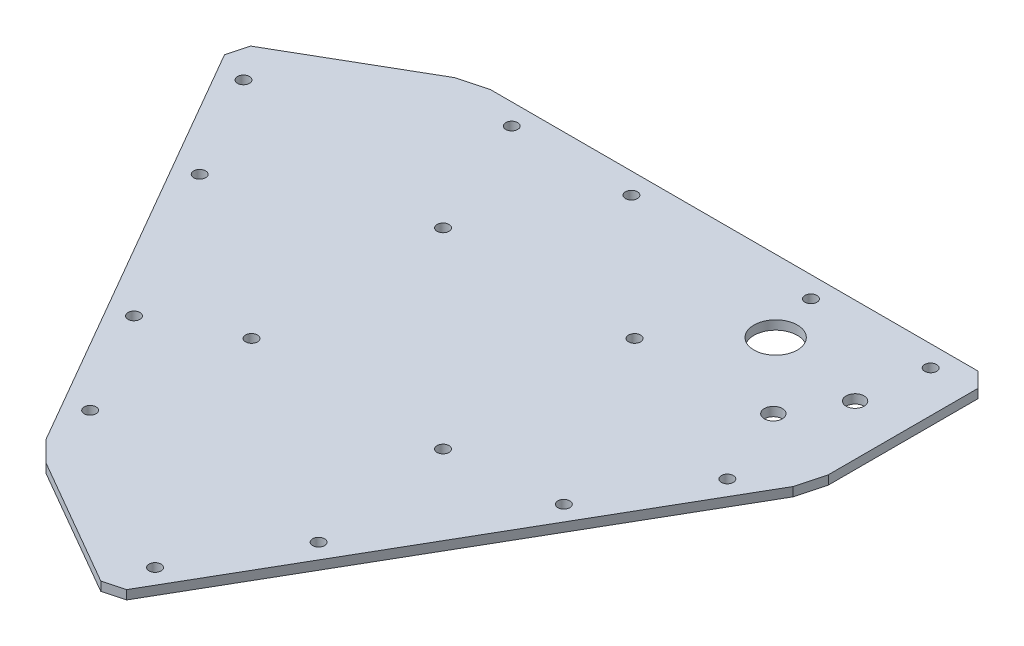
from build123d import *

# Parameters (mm, degrees)
EXTRUSION1_DEPTH              = 3
ENL_V_MAT_EXTRU_14_REACH      = 176.1
ESQUISSE8_R                   = 2
ENL_V_MAT_EXTRU_15_DEPTH      = 175.099861741
ENL_V_MAT_EXTRU_15_DEPTH_BACK = 175.099861741
ESQUISSE9_R                   = 2
ESQUISSE11_R                  = 7.25
ESQUISSE11_R_2                = 3
ENL_V_MAT_EXTRU_17_DEPTH      = 175.099861741


with BuildPart() as part:
    # Esquisse1 → Extrusion1 (new body)
    with BuildSketch(Plane(origin=(0, 0, 0), x_dir=(1, 0, 0), z_dir=(0, 1, 0))):
        Polygon((-64.179491924, 79.940798285), (98.820508076, 79.940798285), (103.820508076, 74.940798285), (103.820508076, 24.940798285), (101.320508076, 15.610671266), (19.820508076, -125.551469551), (12.990381057, -127.38159657), (-30.310889132, -102.38159657), (-37.141016151, -95.551469551), (-118.641016151, 45.610671266), (-116.810889132, 52.440798285), (-73.509618943, 77.440798285), align=None)
    extrude(amount=EXTRUSION1_DEPTH)

    # Esquisse8 → Enlèv. mat.-Extru.14 (cut, up to next)
    with BuildSketch(Plane(origin=(0, 3, 0), x_dir=(1, 0, 0), z_dir=(0, 1, 0)), mode=Mode.PRIVATE) as enl_v_mat_extru_14_sk1:
        with Locations((-108.168584287, 41.471887198)):
            Circle(ESQUISSE8_R)
    enl_v_mat_extru_14_tool1 = extrude(enl_v_mat_extru_14_sk1.sketch, amount=-ENL_V_MAT_EXTRU_14_REACH, mode=Mode.PRIVATE) & part.part
    # Esquisse8 → Enlèv. mat.-Extru.14 (cut, up to next)
    with BuildSketch(Plane(origin=(0, 3, 0), x_dir=(1, 0, 0), z_dir=(0, 1, 0)), mode=Mode.PRIVATE) as enl_v_mat_extru_14_sk2:
        with Locations((90, 72.940798285)):
            Circle(ESQUISSE8_R)
    enl_v_mat_extru_14_tool2 = extrude(enl_v_mat_extru_14_sk2.sketch, amount=-ENL_V_MAT_EXTRU_14_REACH, mode=Mode.PRIVATE) & part.part
    # Esquisse8 → Enlèv. mat.-Extru.14 (cut, up to next)
    with BuildSketch(Plane(origin=(0, 3, 0), x_dir=(1, 0, 0), z_dir=(0, 1, 0)), mode=Mode.PRIVATE) as enl_v_mat_extru_14_sk3:
        with Locations((50, 72.940798285)):
            Circle(ESQUISSE8_R)
    enl_v_mat_extru_14_tool3 = extrude(enl_v_mat_extru_14_sk3.sketch, amount=-ENL_V_MAT_EXTRU_14_REACH, mode=Mode.PRIVATE) & part.part
    # Esquisse8 → Enlèv. mat.-Extru.14 (cut, up to next)
    with BuildSketch(Plane(origin=(0, 3, 0), x_dir=(1, 0, 0), z_dir=(0, 1, 0)), mode=Mode.PRIVATE) as enl_v_mat_extru_14_sk4:
        with Locations((-58.168584287, -45.13065318)):
            Circle(ESQUISSE8_R)
    enl_v_mat_extru_14_tool4 = extrude(enl_v_mat_extru_14_sk4.sketch, amount=-ENL_V_MAT_EXTRU_14_REACH, mode=Mode.PRIVATE) & part.part
    # Esquisse8 → Enlèv. mat.-Extru.14 (cut, up to next)
    with BuildSketch(Plane(origin=(0, 3, 0), x_dir=(1, 0, 0), z_dir=(0, 1, 0)), mode=Mode.PRIVATE) as enl_v_mat_extru_14_sk5:
        with Locations((-38.168584287, -79.771669332)):
            Circle(ESQUISSE8_R)
    enl_v_mat_extru_14_tool5 = extrude(enl_v_mat_extru_14_sk5.sketch, amount=-ENL_V_MAT_EXTRU_14_REACH, mode=Mode.PRIVATE) & part.part
    # Esquisse8 → Enlèv. mat.-Extru.14 (cut, up to next)
    with BuildSketch(Plane(origin=(0, 3, 0), x_dir=(1, 0, 0), z_dir=(0, 1, 0)), mode=Mode.PRIVATE) as enl_v_mat_extru_14_sk6:
        with Locations((-10, 72.940798285)):
            Circle(ESQUISSE8_R)
    enl_v_mat_extru_14_tool6 = extrude(enl_v_mat_extru_14_sk6.sketch, amount=-ENL_V_MAT_EXTRU_14_REACH, mode=Mode.PRIVATE) & part.part
    # Esquisse8 → Enlèv. mat.-Extru.14 (cut, up to next)
    with BuildSketch(Plane(origin=(0, 3, 0), x_dir=(1, 0, 0), z_dir=(0, 1, 0)), mode=Mode.PRIVATE) as enl_v_mat_extru_14_sk7:
        with Locations((-50, 72.940798285)):
            Circle(ESQUISSE8_R)
    enl_v_mat_extru_14_tool7 = extrude(enl_v_mat_extru_14_sk7.sketch, amount=-ENL_V_MAT_EXTRU_14_REACH, mode=Mode.PRIVATE) & part.part
    # Esquisse8 → Enlèv. mat.-Extru.14 (cut, up to next)
    with BuildSketch(Plane(origin=(0, 3, 0), x_dir=(1, 0, 0), z_dir=(0, 1, 0)), mode=Mode.PRIVATE) as enl_v_mat_extru_14_sk8:
        with Locations((18.168584287, -114.412685483)):
            Circle(ESQUISSE8_R)
    enl_v_mat_extru_14_tool8 = extrude(enl_v_mat_extru_14_sk8.sketch, amount=-ENL_V_MAT_EXTRU_14_REACH, mode=Mode.PRIVATE) & part.part
    # Esquisse8 → Enlèv. mat.-Extru.14 (cut, up to next)
    with BuildSketch(Plane(origin=(0, 3, 0), x_dir=(1, 0, 0), z_dir=(0, 1, 0)), mode=Mode.PRIVATE) as enl_v_mat_extru_14_sk9:
        with Locations((38.168584287, -79.771669332)):
            Circle(ESQUISSE8_R)
    enl_v_mat_extru_14_tool9 = extrude(enl_v_mat_extru_14_sk9.sketch, amount=-ENL_V_MAT_EXTRU_14_REACH, mode=Mode.PRIVATE) & part.part
    # Esquisse8 → Enlèv. mat.-Extru.14 (cut, up to next)
    with BuildSketch(Plane(origin=(0, 3, 0), x_dir=(1, 0, 0), z_dir=(0, 1, 0)), mode=Mode.PRIVATE) as enl_v_mat_extru_14_sk10:
        with Locations((-88.168584287, 6.830871047)):
            Circle(ESQUISSE8_R)
    enl_v_mat_extru_14_tool10 = extrude(enl_v_mat_extru_14_sk10.sketch, amount=-ENL_V_MAT_EXTRU_14_REACH, mode=Mode.PRIVATE) & part.part
    # Esquisse8 → Enlèv. mat.-Extru.14 (cut, up to next)
    with BuildSketch(Plane(origin=(0, 3, 0), x_dir=(1, 0, 0), z_dir=(0, 1, 0)), mode=Mode.PRIVATE) as enl_v_mat_extru_14_sk11:
        with Locations((68.168584287, -27.810145105)):
            Circle(ESQUISSE8_R)
    enl_v_mat_extru_14_tool11 = extrude(enl_v_mat_extru_14_sk11.sketch, amount=-ENL_V_MAT_EXTRU_14_REACH, mode=Mode.PRIVATE) & part.part
    # Esquisse8 → Enlèv. mat.-Extru.14 (cut, up to next)
    with BuildSketch(Plane(origin=(0, 3, 0), x_dir=(1, 0, 0), z_dir=(0, 1, 0)), mode=Mode.PRIVATE) as enl_v_mat_extru_14_sk12:
        with Locations((88.168584287, 6.830871047)):
            Circle(ESQUISSE8_R)
    enl_v_mat_extru_14_tool12 = extrude(enl_v_mat_extru_14_sk12.sketch, amount=-ENL_V_MAT_EXTRU_14_REACH, mode=Mode.PRIVATE) & part.part
    add(enl_v_mat_extru_14_tool1.solids().sort_by_distance((-108.168584, 3, -41.471887))[0], mode=Mode.SUBTRACT)
    add(enl_v_mat_extru_14_tool2.solids().sort_by_distance((90, 3, -72.940798))[0], mode=Mode.SUBTRACT)
    add(enl_v_mat_extru_14_tool3.solids().sort_by_distance((50, 3, -72.940798))[0], mode=Mode.SUBTRACT)
    add(enl_v_mat_extru_14_tool4.solids().sort_by_distance((-58.168584, 3, 45.130653))[0], mode=Mode.SUBTRACT)
    add(enl_v_mat_extru_14_tool5.solids().sort_by_distance((-38.168584, 3, 79.771669))[0], mode=Mode.SUBTRACT)
    add(enl_v_mat_extru_14_tool6.solids().sort_by_distance((-10, 3, -72.940798))[0], mode=Mode.SUBTRACT)
    add(enl_v_mat_extru_14_tool7.solids().sort_by_distance((-50, 3, -72.940798))[0], mode=Mode.SUBTRACT)
    add(enl_v_mat_extru_14_tool8.solids().sort_by_distance((18.168584, 3, 114.412685))[0], mode=Mode.SUBTRACT)
    add(enl_v_mat_extru_14_tool9.solids().sort_by_distance((38.168584, 3, 79.771669))[0], mode=Mode.SUBTRACT)
    add(enl_v_mat_extru_14_tool10.solids().sort_by_distance((-88.168584, 3, -6.830871))[0], mode=Mode.SUBTRACT)
    add(enl_v_mat_extru_14_tool11.solids().sort_by_distance((68.168584, 3, 27.810145))[0], mode=Mode.SUBTRACT)
    add(enl_v_mat_extru_14_tool12.solids().sort_by_distance((88.168584, 3, -6.830871))[0], mode=Mode.SUBTRACT)

    # Esquisse9 → Enlèv. mat.-Extru.15 (cut, two sides: drawn at the far end of the back side and taken through both)
    with BuildSketch(Plane(origin=(0, 3, 0), x_dir=(1, 0, 0), z_dir=(0, 1, 0)).offset(-ENL_V_MAT_EXTRU_15_DEPTH_BACK)):
        with Locations((-32, 32)):
            Circle(ESQUISSE9_R)
        with Locations((32, 32)):
            Circle(ESQUISSE9_R)
        with Locations((32, -32)):
            Circle(ESQUISSE9_R)
        with Locations((-32, -32)):
            Circle(ESQUISSE9_R)
    extrude(amount=ENL_V_MAT_EXTRU_15_DEPTH + ENL_V_MAT_EXTRU_15_DEPTH_BACK, mode=Mode.SUBTRACT)

    # Esquisse11 → Enlèv. mat.-Extru.17 (cut, through all)
    with BuildSketch(Plane(origin=(0, 3, 0), x_dir=(1, 0, 0), z_dir=(0, 1, 0))):
        with Locations((55.303878216, 55.842402688)):
            Circle(ESQUISSE11_R)
        with Locations((76.955146891, 33.408627749)):
            Circle(ESQUISSE11_R_2)
        with Locations((86.955146891, 50.729135825)):
            Circle(ESQUISSE11_R_2)
    extrude(amount=-ENL_V_MAT_EXTRU_17_DEPTH, mode=Mode.SUBTRACT)


solid = part.part
